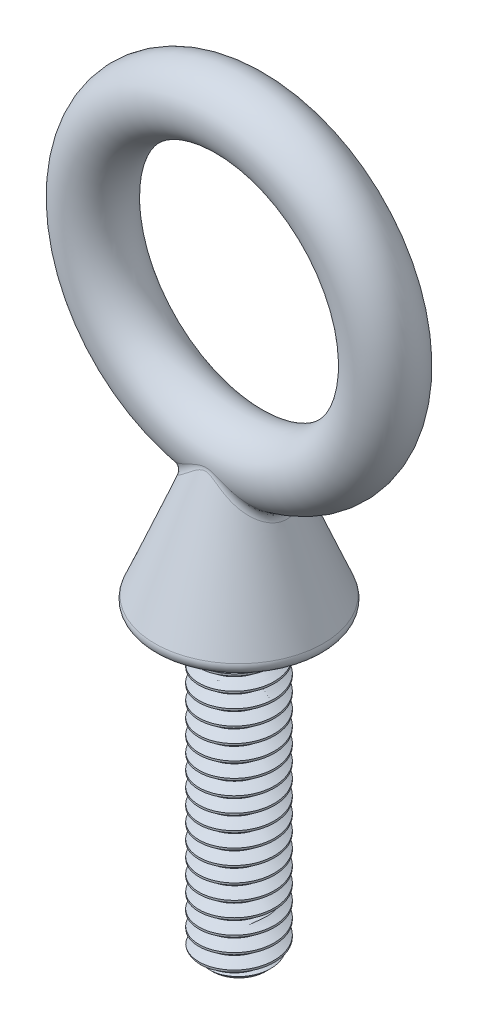
from build123d import *
from build123d.topology import SkipClean

# Parameters (mm, degrees)
BOSS_EXTRUDE1_START = -23.8125
SKETCH2_R           = 3.175
BOSS_EXTRUDE1_DEPTH = 25.4
SKETCH5_OUTSIDE_W   = 67.326
SKETCH5_OUTSIDE_H   = 67.326
SKETCH5_OUTSIDE_R   = 2.21262927
CUT_EXTRUDE1_DEPTH  = 26.793821935
CUT_EXTRUDE1_DRAFT  = -45
SKETCH6_R           = 2.778125
FILLET1_R           = 0.69453125
CUT_SWEEP1_PITCH    = 1.27
CUT_SWEEP1_TO       = 25.4
SKETCH9_R           = 3.175
BOSS_EXTRUDE2_DEPTH = 2.54
BOSS_EXTRUDE2_TAPER = 45


with BuildPart() as part:
    # Sketch2 → Boss-Extrude1 (new body)
    with BuildSketch(Plane(origin=(0, 0, 0), x_dir=(1, 0, 0), z_dir=(0, 1, 0)).offset(BOSS_EXTRUDE1_START)):
        with Locations(Location((0, 0, 0), (0, 0, 270))):
            Circle(SKETCH2_R)
    extrude(amount=-BOSS_EXTRUDE1_DEPTH)


with BuildPart() as cut_extrude1_tool:
    # Sketch5 outside → Cut-Extrude1 (with draft: the straight prism first)
    with BuildSketch(Plane.XZ.offset(49.2125)):
        Rectangle(SKETCH5_OUTSIDE_W, SKETCH5_OUTSIDE_H)
        Circle(SKETCH5_OUTSIDE_R, mode=Mode.SUBTRACT)
    extrude(amount=-CUT_EXTRUDE1_DEPTH)
    # Cut-Extrude1: the draft: its side faces are tilted about the plane it starts from
    cut_extrude1_sides = [cut_extrude1_tool.faces().sort_by_distance(p)[0] for p in [
        (0, -35.815589033, -33.663),
        (33.663, -35.815589033, 0),
        (0, -35.815589033, 33.663),
        (-33.663, -35.815589033, 0),
        (-2.21262927, -35.815589033, 0),
    ]]
    draft(cut_extrude1_sides, Plane.XZ.offset(49.2125), CUT_EXTRUDE1_DRAFT)


with BuildPart() as part_1:
    add(part.part)

    # Cut-Extrude1: cut by cut_extrude1_tool
    add(cut_extrude1_tool.part, mode=Mode.SUBTRACT)



with BuildPart() as body_2:
    # Sketch6 → Revolve1 (revolve)
    with BuildSketch(Plane(origin=(0, 0, 0), x_dir=(0, 0, -1), z_dir=(1, 0, 0)), mode=Mode.PRIVATE) as revolve1_sk:
        with Locations((0, 12.303125)):
            Circle(SKETCH6_R)
    revolve(revolve1_sk.sketch.rotate(Axis((0, 0, -7.63984375), (0, 0, 1)), 90), axis=Axis((0, 0, -7.63984375), (0, 0, 1)))


with BuildPart() as part_2:
    with SkipClean():  # the faces are left unmerged after this step: merging them gives an invalid solid
        add(part_1.part)

        add(body_2.part)  # Revolve2 merges body 2
        # Sketch8 → Revolve2 (revolve)
        with BuildSketch(Plane.XY, mode=Mode.PRIVATE) as revolve2_sk:
            with BuildLine():
                Line((0, -23.8125), (0, -12.303125))
                Line((0, -12.303125), (-2.778125, -12.303125))
                Line((-2.778125, -12.303125), (-7.092098939, -22.855140441))
                ThreePointArc((-7.092098939, -22.855140441), (-7.025810517, -23.505158098), (-6.44921875, -23.8125))
                Line((-6.44921875, -23.8125), (0, -23.8125))
            make_face()
        revolve(revolve2_sk.sketch.rotate(Axis((0, -23.8125, 0), (0, 1, 0)), 270), axis=Axis((0, -23.8125, 0), (0, 1, 0)))

    # Fillet1
    fillet1_edges = [part_2.edges().sort_by_distance(p)[0] for p in [
        (3.723072169, -14.614473483, -6e-09),
    ]]
    fillet(fillet1_edges, radius=FILLET1_R)


with BuildPart() as body_2_2:
    # Split1: the piece on the far side of the plane
    add(part_2.part)
    split(bisect_by=Plane(origin=(0, -23.8125, 0), x_dir=(-1, 0, 0), z_dir=(0, -1, 0)), keep=Keep.BOTTOM)


with BuildPart() as part_3:
    add(part_2.part)

    # Split1
    split(bisect_by=Plane(origin=(0, -23.8125, 0), x_dir=(-1, 0, 0), z_dir=(0, -1, 0)), keep=Keep.TOP)

    # Cut-Sweep1: arcs per turn and ends read off the stored shape
    # Cut-Sweep1: the profile of Sketch4 screwed along a right-hand helix through 21 turns, 8 arcs to a turn; built about Z, then put on its axis
    cut_sweep1_z = Axis((0, 0, 0), (0, 0, 1))
    cut_sweep1_corners = [(2.350110803, 0, -0.47625), (2.350110803, 0, -0.635), (3.243740766, 0, -1.1509375), (3.243740766, 0, 0.0396875)]
    with BuildLine(mode=Mode.PRIVATE) as cut_sweep1_profile:
        Line(cut_sweep1_corners[0], cut_sweep1_corners[1])
        Line(cut_sweep1_corners[1], cut_sweep1_corners[2])
        Line(cut_sweep1_corners[2], cut_sweep1_corners[3])
        Line(cut_sweep1_corners[3], cut_sweep1_corners[0])
    cut_sweep1_cap = Face(cut_sweep1_profile.wire())
    cut_sweep1_turn_angles = [0, 22.5, 45, 67.5, 90, 112.5, 135, 157.5, 180, 202.5, 225, 247.5, 270, 292.5, 315, 337.5, 360]
    cut_sweep1_turn_weights = [1, 0.9238795325112867, 1, 0.9238795325112867, 1, 0.9238795325112867, 1, 0.9238795325112867, 1, 0.9238795325112867, 1, 0.9238795325112867, 1, 0.9238795325112867, 1, 0.9238795325112867, 1]
    cut_sweep1_turn_rails = [Edge.make_bspline([Vector(p[0], p[1], 0).rotate(cut_sweep1_z, cut_sweep1_turn_angles[k]) / cut_sweep1_turn_weights[k] + Vector(0, 0, p[2] + CUT_SWEEP1_PITCH * cut_sweep1_turn_angles[k] / 360) for k in range(17)], [0, 0, 0, 1, 1, 2, 2, 3, 3, 4, 4, 5, 5, 6, 6, 7, 7, 8, 8, 8], 2, cut_sweep1_turn_weights) for p in cut_sweep1_corners]
    cut_sweep1_turn_sides = [Face.make_surface_from_curves(cut_sweep1_turn_rails[p[0]], cut_sweep1_turn_rails[p[1]]) for p in [(0, 1), (1, 2), (2, 3), (3, 0)]]
    cut_sweep1 = Plane(origin=(0, -49.2125, 0), x_dir=(1, 0, 0), z_dir=(0, 1, 0)) * split(Solid(Shell([*[p.moved(Location((0, 0, CUT_SWEEP1_PITCH * i))) for i in range(21) for p in cut_sweep1_turn_sides], cut_sweep1_cap, cut_sweep1_cap.rotate(cut_sweep1_z, 7560).moved(Location((0, 0, CUT_SWEEP1_PITCH * 7560 / 360)))])), bisect_by=Plane.XY.offset(CUT_SWEEP1_TO), keep=Keep.BOTTOM, mode=Mode.PRIVATE)
    add(cut_sweep1, mode=Mode.SUBTRACT)

    add(body_2_2.part)  # Boss-Extrude2 merges body 2 2
    # Sketch9 → Boss-Extrude2 (add)
    with BuildSketch(Plane.XZ.offset(23.8125)):
        Circle(SKETCH9_R)
    extrude(amount=BOSS_EXTRUDE2_DEPTH, taper=BOSS_EXTRUDE2_TAPER)


solid = part_3.part
